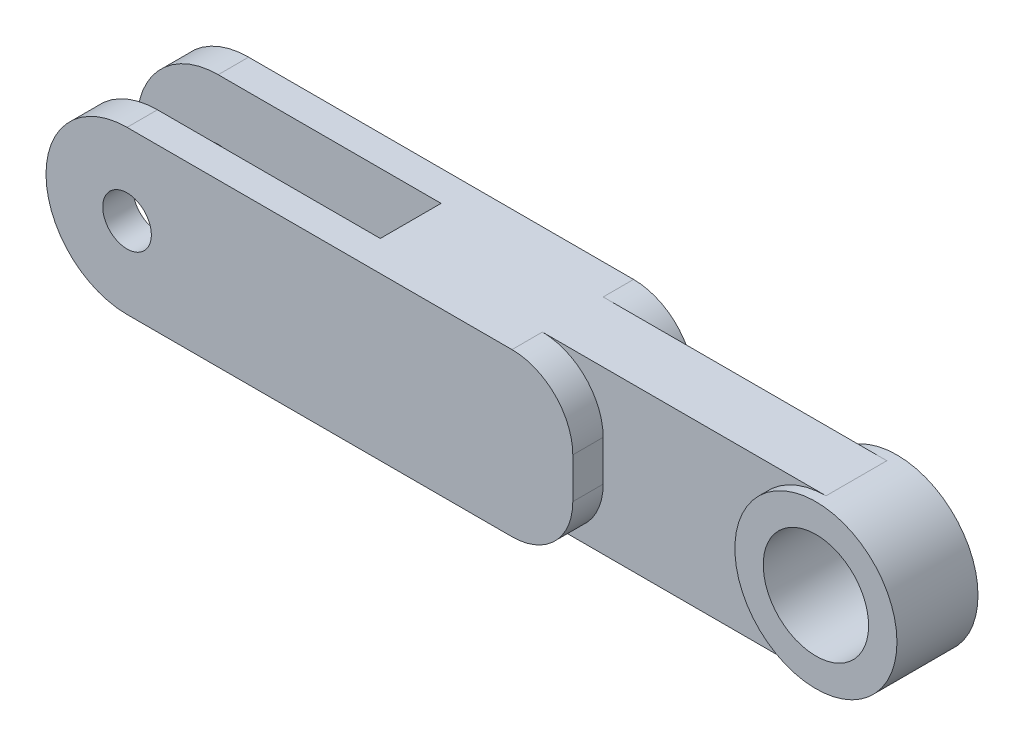
from build123d import *
from build123d.topology import SkipClean

# Parameters (mm, degrees)
EXTRUDE_1_DEPTH          = 3
EXTRUDE_1_DEPTH_BACK     = 3
SKETCH_1_R               = 1.025
SKETCH_1_R_2             = 2.6
CUT_EXTRUDE_1_DEPTH      = 10
CUT_EXTRUDE_1_DEPTH_BACK = 10
SKETCH_3_W               = 15
SKETCH_3_H               = 3
SKETCH_3_H_2             = 1.5
FILLET_1_R               = 3
SKETCH_4_R               = 4
SKETCH_4_R_2             = 2.6
EXTRUDE_2_DEPTH          = 0.5
EXTRUDE_START            = 0.5
SKETCH_5_R               = 2.6
EXTRUDE_3_DEPTH          = 0.5
SKETCH_6_R               = 1.2
CUT_EXTRUDE_2_DEPTH      = 2
SCALE_1_SCALE            = 0.6


with BuildPart() as part:
    # 草图1 → 凸台-拉伸1 (new, two sides: drawn at the far end of the back side and taken through both)
    with BuildSketch(Plane.XY.offset(-EXTRUDE_1_DEPTH_BACK)):
        with BuildLine():
            Line((-21, 4), (12, 4))
            ThreePointArc((12, 4), (16, 0), (12, -4))
            Line((12, -4), (-21, -4))
            ThreePointArc((-21, -4), (-25, 0), (-21, 4))
        make_face()
        with Locations((-21, 0)):
            Circle(SKETCH_1_R, mode=Mode.SUBTRACT)
        with Locations((12, 0)):
            Circle(SKETCH_1_R_2, mode=Mode.SUBTRACT)
    extrude(amount=EXTRUDE_1_DEPTH + EXTRUDE_1_DEPTH_BACK)

    # 草图3 → 切除-拉伸1 (cut, two sides: drawn at the far end of the back side and taken through both)
    with BuildSketch(Plane(origin=(0, 0, 0), x_dir=(1, 0, 0), z_dir=(0, 1, 0)).offset(-CUT_EXTRUDE_1_DEPTH_BACK)):
        with Locations((-17.5, 0)):
            Rectangle(SKETCH_3_W, SKETCH_3_H)
        with Locations((8.5, 2.25)):
            Rectangle(SKETCH_3_W, SKETCH_3_H_2)
        with Locations((8.5, -2.25)):
            Rectangle(SKETCH_3_W, SKETCH_3_H_2)
    extrude(amount=CUT_EXTRUDE_1_DEPTH + CUT_EXTRUDE_1_DEPTH_BACK, mode=Mode.SUBTRACT)

    # 圆角1
    fillet_1_edges = [part.edges().sort_by_distance(p)[0] for p in [
        (1, -4, 2.25),
        (1, 4, 2.25),
        (1, -4, -2.25),
        (1, 4, -2.25),
    ]]
    fillet(fillet_1_edges, radius=FILLET_1_R)

    # 草图4 → 凸台-拉伸2 (add)
    with SkipClean():  # the faces are left unmerged after this step: merging them gives an invalid solid
        with BuildSketch(Plane.XY.offset(1.5)):
            with Locations((12, 0)):
                Circle(SKETCH_4_R)
            with Locations((12, 0)):
                Circle(SKETCH_4_R_2, mode=Mode.SUBTRACT)
        extrude(amount=EXTRUDE_2_DEPTH)
    add(part.part.scale(1), mode=Mode.REPLACE)  # the faces are merged on a copy

    # 草图5 → 凸台-拉伸3 (add)
    with BuildSketch(Plane(origin=(0, 0, -1.5), x_dir=(-1, 0, 0), z_dir=(0, 0, -1)).offset(EXTRUDE_START)):
        with BuildLine():
            ThreePointArc((-12, 4), (-16, 0), (-12, -4))
            ThreePointArc((-12, -4), (-8, 0), (-12, 4))
        make_face()
        with Locations((-12, 0)):
            Circle(SKETCH_5_R, mode=Mode.SUBTRACT)
    extrude(amount=-EXTRUDE_3_DEPTH)

    # 草图6 → 切除-拉伸2 (cut)
    with BuildSketch(Plane.XY.offset(3)):
        with Locations((-21, 0)):
            Circle(SKETCH_6_R)
    extrude(amount=-CUT_EXTRUDE_2_DEPTH, mode=Mode.SUBTRACT)


with BuildPart() as part_1:
    # 缩放比例1: scaled about (0, 0, 0)
    add(part.part.scale(SCALE_1_SCALE))


solid = part_1.part
